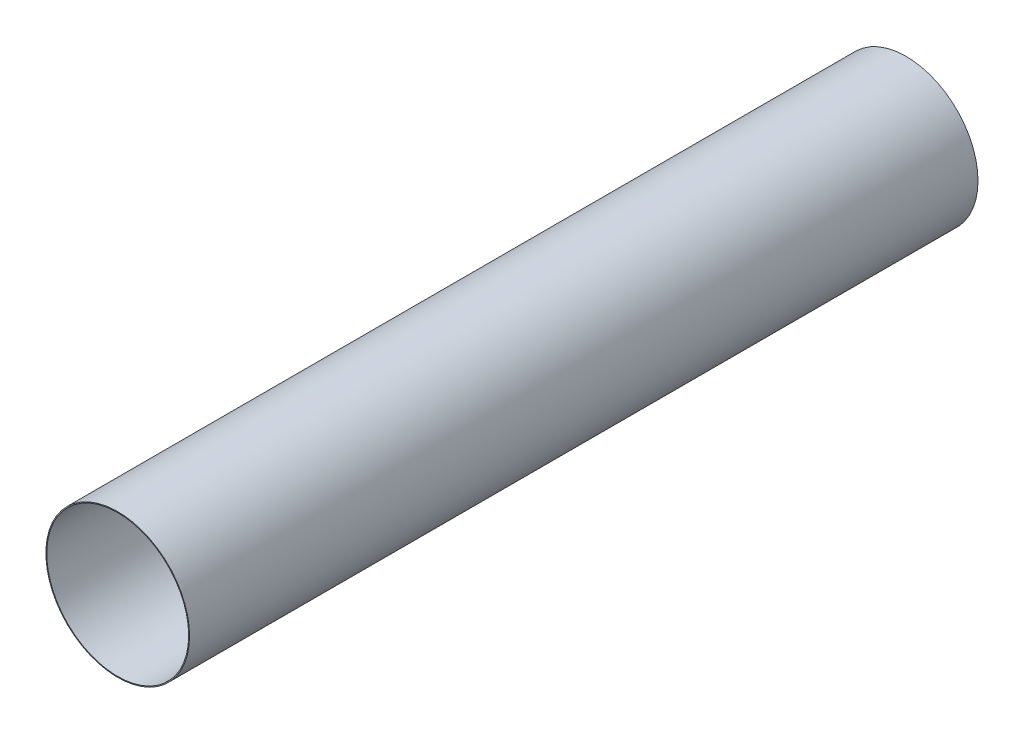
from build123d import *

# Parameters (mm, degrees)
SKETCH1_R           = 82
SKETCH1_R_2         = 81
BOSS_EXTRUDE1_DEPTH = 450


with BuildPart() as part:
    # Sketch1 → Boss-Extrude1 (new, symmetric)
    with BuildSketch(Plane.XY):
        Circle(SKETCH1_R)
        Circle(SKETCH1_R_2, mode=Mode.SUBTRACT)
    extrude(amount=BOSS_EXTRUDE1_DEPTH, both=True)


solid = part.part
